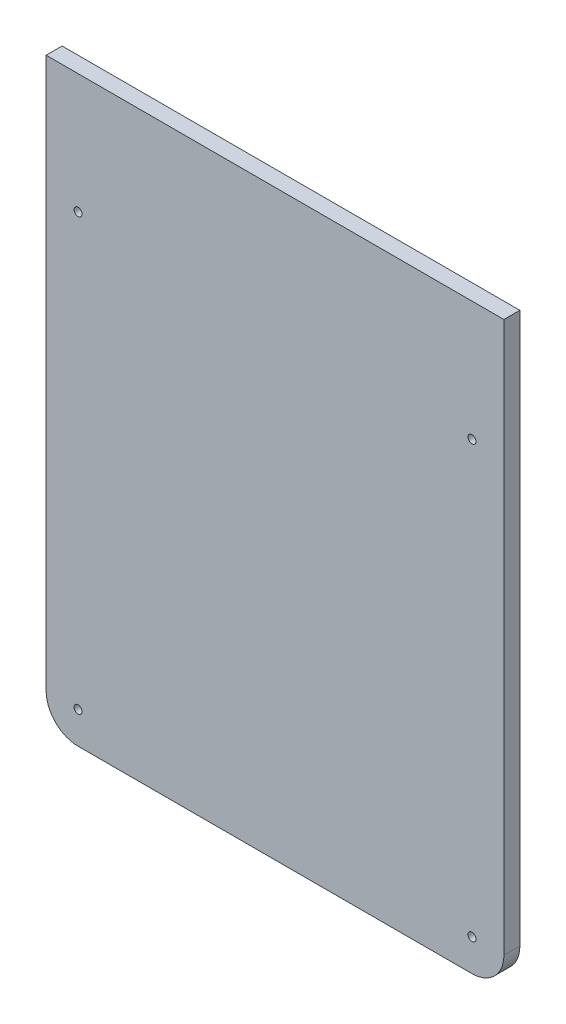
from build123d import *

# Parameters (mm, degrees)
BOSS_EXTRUDE1_DEPTH = 6.35
HOLE1_D             = 3.175
HOLE1_DEPTH         = 31.75
HOLE1_CSINK_D       = 10.16
HOLE1_CSINK_ANGLE   = 82
HOLE1_TIP           = 0.953866233


with BuildPart() as part:
    # Sketch1 → Boss-Extrude1 (new body)
    with BuildSketch(Plane.XY):
        with BuildLine():
            Line((-19.05, 903.02716301), (163.099999994, 903.02716301))
            Line((163.099999994, 903.02716301), (163.099999994, 683.95216301))
            ThreePointArc((163.099999994, 683.95216301), (159.380256115, 674.971906889), (150.399999994, 671.25216301))
            Line((150.399999994, 671.25216301), (-6.35, 671.25216301))
            ThreePointArc((-6.35, 671.25216301), (-15.330256121, 674.971906889), (-19.05, 683.95216301))
            Line((-19.05, 683.95216301), (-19.05, 903.02716301))
        make_face()
    extrude(amount=BOSS_EXTRUDE1_DEPTH)

    # Hole1
    with Locations(Plane(origin=(72.024999997, -437.637032837, 19.05), x_dir=(1, 0, 0), z_dir=(0, 0, 1))):
        with Locations((-78.374999997, 1293.039195846), (-78.374999997, 1121.589195846), (78.374999997, 1121.589195846), (78.374999997, 1293.039195846)):
            CounterSinkHole(HOLE1_D / 2, HOLE1_CSINK_D / 2, depth=HOLE1_DEPTH, counter_sink_angle=HOLE1_CSINK_ANGLE)
            with Locations((0, 0, -(HOLE1_DEPTH + HOLE1_TIP / 2))):  # 118° drill point
                Cone(0, HOLE1_D / 2, HOLE1_TIP, mode=Mode.SUBTRACT)


solid = part.part
